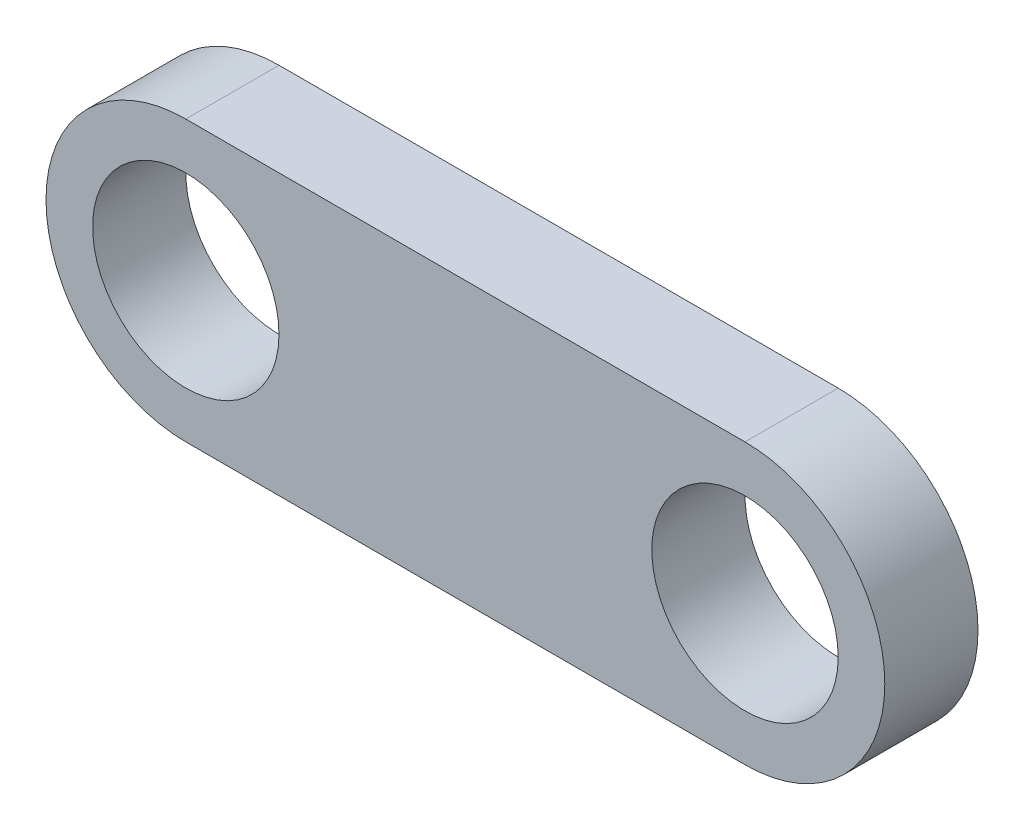
from build123d import *

# Parameters (mm, degrees)
SKETCH1_R           = 5
BOSS_EXTRUDE1_DEPTH = 5


with BuildPart() as part:
    # Sketch1 → Boss-Extrude1 (new body)
    with BuildSketch(Plane.XY):
        with BuildLine():
            ThreePointArc((0, 7.5), (-7.5, 0), (0, -7.5))
            Line((0, -7.5), (30, -7.5))
            ThreePointArc((30, -7.5), (37.5, 0), (30, 7.5))
            Line((30, 7.5), (0, 7.5))
        make_face()
        Circle(SKETCH1_R, mode=Mode.SUBTRACT)
        with Locations((30, 0)):
            Circle(SKETCH1_R, mode=Mode.SUBTRACT)
    extrude(amount=BOSS_EXTRUDE1_DEPTH)


solid = part.part
